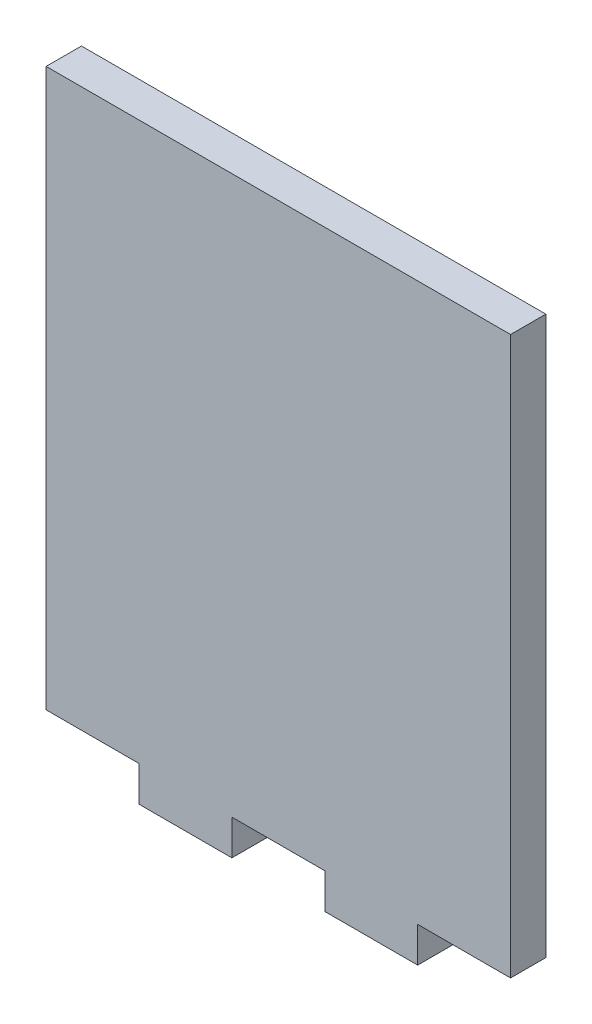
from build123d import *

# Parameters (mm, degrees)
SKETCH1_W           = 63.5
SKETCH1_H           = 81.026
BOSS_EXTRUDE1_DEPTH = 4.826
SKETCH2_W           = 12.7
SKETCH2_H           = 4.826
CUT_EXTRUDE1_DEPTH  = 104.057037373


with BuildPart() as part:
    # Sketch1 → Boss-Extrude1 (new body)
    with BuildSketch(Plane.XY):
        with Locations((31.75, 40.513)):
            Rectangle(SKETCH1_W, SKETCH1_H)
    extrude(amount=BOSS_EXTRUDE1_DEPTH)

    # Sketch2 → Cut-Extrude1 (cut, through all)
    with BuildSketch(Plane.XY.offset(4.826)):
        with Locations((6.35, 2.413)):
            Rectangle(SKETCH2_W, SKETCH2_H)
        with Locations((31.75, 2.413)):
            Rectangle(SKETCH2_W, SKETCH2_H)
        with Locations((57.15, 2.413)):
            Rectangle(SKETCH2_W, SKETCH2_H)
    extrude(amount=-CUT_EXTRUDE1_DEPTH, mode=Mode.SUBTRACT)


solid = part.part
